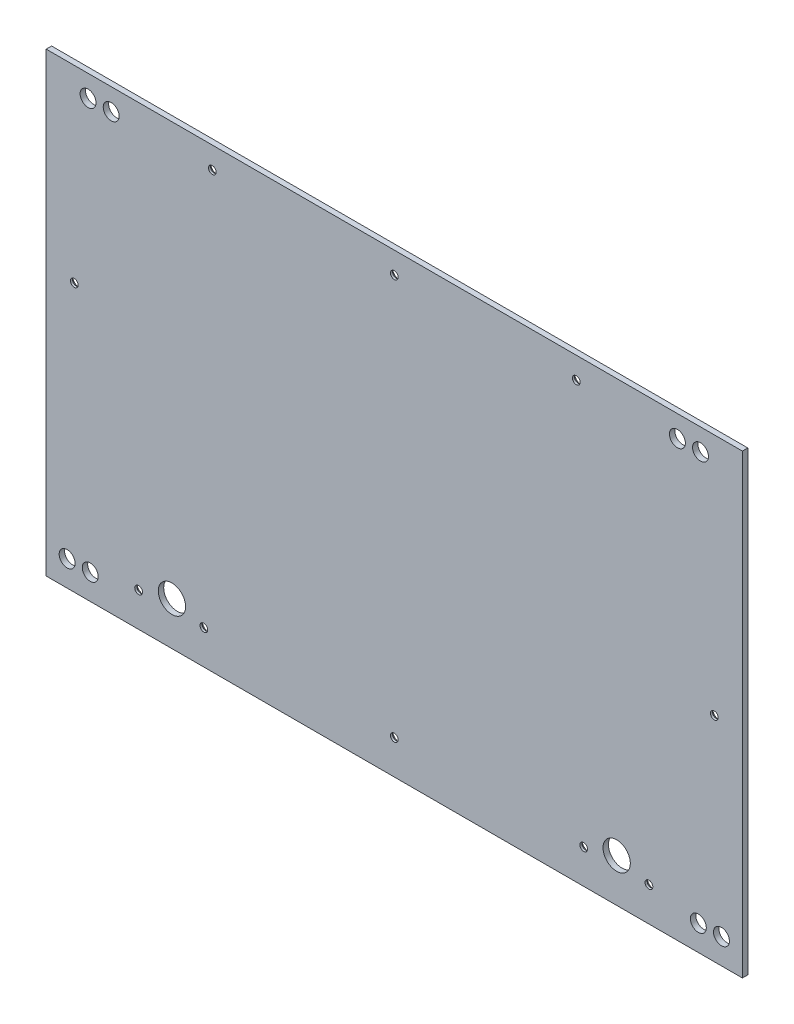
from build123d import *

# Parameters (mm, degrees)
SKETCH1_W                                      = 306.05
SKETCH1_H                                      = 197.425
BOSS_EXTRUDE1_DEPTH                            = 2.38125
SKETCH9_W                                      = 306.05
SKETCH9_H                                      = 2.38125
BOSS_EXTRUDE2_DEPTH                            = 3.175
SKETCH10_R                                     = 3.5
CUT_EXTRUDE1_DEPTH                             = 184.856965146
CSK_FOR_M3_FLAT_HEAD_MACHINE_SCREW1_AT_2_COUNT = 2
CSK_FOR_M3_FLAT_HEAD_MACHINE_SCREW1_AT_2_PITCH = 28.69
CSK_FOR_M3_FLAT_HEAD_MACHINE_SCREW1_AT_3_COUNT = 2
CSK_FOR_M3_FLAT_HEAD_MACHINE_SCREW1_AT_3_PITCH = 83.856540491
CSK_FOR_M3_FLAT_HEAD_MACHINE_SCREW1_AT_4_COUNT = 2
CSK_FOR_M3_FLAT_HEAD_MACHINE_SCREW1_AT_4_PITCH = 178.948509983
CSK_FOR_M3_FLAT_HEAD_MACHINE_SCREW1_AT_5_COUNT = 2
CSK_FOR_M3_FLAT_HEAD_MACHINE_SCREW1_AT_5_PITCH = 208.645558843
CSK_FOR_M3_FLAT_HEAD_MACHINE_SCREW1_AT_6_COUNT = 2
CSK_FOR_M3_FLAT_HEAD_MACHINE_SCREW1_AT_6_PITCH = 260.467597265
CSK_FOR_M3_FLAT_HEAD_MACHINE_SCREW1_AT_7_COUNT = 2
CSK_FOR_M3_FLAT_HEAD_MACHINE_SCREW1_AT_7_PITCH = 272.733119364
CSK_FOR_M3_FLAT_HEAD_MACHINE_SCREW1_AT_8_COUNT = 2
CSK_FOR_M3_FLAT_HEAD_MACHINE_SCREW1_AT_8_PITCH = 224.342
CSK_FOR_M3_FLAT_HEAD_MACHINE_SCREW1_AT_9_COUNT = 2
CSK_FOR_M3_FLAT_HEAD_MACHINE_SCREW1_AT_9_PITCH = 195.652
CSK_FOR_M3_FLAT_HEAD_MACHINE_SCREW1_AT_1_COUNT = 2
CSK_FOR_M3_FLAT_HEAD_MACHINE_SCREW1_AT_1_PITCH = 111.94
SKETCH13_R                                     = 6
CUT_EXTRUDE2_DEPTH                             = 184.856965146


with BuildPart() as part:
    # Sketch1 → Boss-Extrude1 (new body)
    with BuildSketch(Plane.XY):
        Rectangle(SKETCH1_W, SKETCH1_H)
    extrude(amount=BOSS_EXTRUDE1_DEPTH)

    # Sketch9 → Boss-Extrude2 (add)
    with BuildSketch(Plane(origin=(0, 98.7125, 0), x_dir=(1, 0, 0), z_dir=(0, 1, 0))):
        with Locations((0, -1.190625)):
            Rectangle(SKETCH9_W, SKETCH9_H)
    extrude(amount=BOSS_EXTRUDE2_DEPTH)

    # Sketch10 → Cut-Extrude1 (cut, through all)
    with BuildSketch(Plane(origin=(0, 0, 0), x_dir=(-1, 0, 0), z_dir=(0, 0, -1))):
        with Locations((-134.610000066, 92.362499989)):
            Circle(SKETCH10_R)
        with Locations((-124.450000066, 92.362499989)):
            Circle(SKETCH10_R)
        with Locations((-143.817500066, -87.537500111)):
            Circle(SKETCH10_R)
        with Locations((-133.657500066, -87.537500111)):
            Circle(SKETCH10_R)
    cut_extrude1 = extrude(amount=-CUT_EXTRUDE1_DEPTH, mode=Mode.SUBTRACT)

    # Mirror1: Cut-Extrude1 across plane
    add(cut_extrude1.mirror(Plane(origin=(0, 0, 0), x_dir=(0, 0, 1), z_dir=(1, 0, 0))), mode=Mode.SUBTRACT)

    # Sketch12 → CSK for M3 Flat Head Machine Screw1 (revolve, cut)
    with BuildSketch(Plane(origin=(111.94, -83.712500011, 0), x_dir=(0, 1, 0), z_dir=(1, 0, 0))):
        Polygon((0, 0), (0, 2.38125), (1.7, 2.38125), (1.7, 1.45), (3.15, 0), align=None)
    csk_for_m3_flat_head_machine_screw1 = revolve(axis=Axis((111.94, -83.712500011, -6.35), (0, 0, 1)), mode=Mode.SUBTRACT)

    # CSK for M3 Flat Head Machine Screw1 at 2: CSK for M3 Flat Head Machine Screw1 ×2
    with Locations(*[(-i * CSK_FOR_M3_FLAT_HEAD_MACHINE_SCREW1_AT_2_PITCH, 0, 0) for i in range(1, CSK_FOR_M3_FLAT_HEAD_MACHINE_SCREW1_AT_2_COUNT)]):
        add(csk_for_m3_flat_head_machine_screw1, mode=Mode.SUBTRACT)

    # CSK for M3 Flat Head Machine Screw1 at 3: CSK for M3 Flat Head Machine Screw1 ×2
    with Locations(*[Vector(0.3428176247747529, 0.9394019779326616, 0) * (i * CSK_FOR_M3_FLAT_HEAD_MACHINE_SCREW1_AT_3_PITCH) for i in range(1, CSK_FOR_M3_FLAT_HEAD_MACHINE_SCREW1_AT_3_COUNT)]):
        add(csk_for_m3_flat_head_machine_screw1, mode=Mode.SUBTRACT)

    # CSK for M3 Flat Head Machine Screw1 at 4: CSK for M3 Flat Head Machine Screw1 ×2
    with Locations(*[Vector(-0.17848709666868778, 0.9839422525345594, 0) * (i * CSK_FOR_M3_FLAT_HEAD_MACHINE_SCREW1_AT_4_PITCH) for i in range(1, CSK_FOR_M3_FLAT_HEAD_MACHINE_SCREW1_AT_4_COUNT)]):
        add(csk_for_m3_flat_head_machine_screw1, mode=Mode.SUBTRACT)

    # CSK for M3 Flat Head Machine Screw1 at 5: CSK for M3 Flat Head Machine Screw1 ×2
    with Locations(*[Vector(-0.5365079449598494, 0.8438952689729687, 0) * (i * CSK_FOR_M3_FLAT_HEAD_MACHINE_SCREW1_AT_5_PITCH) for i in range(1, CSK_FOR_M3_FLAT_HEAD_MACHINE_SCREW1_AT_5_COUNT)]):
        add(csk_for_m3_flat_head_machine_screw1, mode=Mode.SUBTRACT)

    # CSK for M3 Flat Head Machine Screw1 at 6: CSK for M3 Flat Head Machine Screw1 ×2
    with Locations(*[Vector(-0.7369054808176528, 0.6759957931384662, 0) * (i * CSK_FOR_M3_FLAT_HEAD_MACHINE_SCREW1_AT_6_PITCH) for i in range(1, CSK_FOR_M3_FLAT_HEAD_MACHINE_SCREW1_AT_6_COUNT)]):
        add(csk_for_m3_flat_head_machine_screw1, mode=Mode.SUBTRACT)

    # CSK for M3 Flat Head Machine Screw1 at 7: CSK for M3 Flat Head Machine Screw1 ×2
    with Locations(*[Vector(-0.9262809761508282, 0.37683358823367785, 0) * (i * CSK_FOR_M3_FLAT_HEAD_MACHINE_SCREW1_AT_7_PITCH) for i in range(1, CSK_FOR_M3_FLAT_HEAD_MACHINE_SCREW1_AT_7_COUNT)]):
        add(csk_for_m3_flat_head_machine_screw1, mode=Mode.SUBTRACT)

    # CSK for M3 Flat Head Machine Screw1 at 8: CSK for M3 Flat Head Machine Screw1 ×2
    with Locations(*[(-i * CSK_FOR_M3_FLAT_HEAD_MACHINE_SCREW1_AT_8_PITCH, 0, 0) for i in range(1, CSK_FOR_M3_FLAT_HEAD_MACHINE_SCREW1_AT_8_COUNT)]):
        add(csk_for_m3_flat_head_machine_screw1, mode=Mode.SUBTRACT)

    # CSK for M3 Flat Head Machine Screw1 at 9: CSK for M3 Flat Head Machine Screw1 ×2
    with Locations(*[(-i * CSK_FOR_M3_FLAT_HEAD_MACHINE_SCREW1_AT_9_PITCH, 0, 0) for i in range(1, CSK_FOR_M3_FLAT_HEAD_MACHINE_SCREW1_AT_9_COUNT)]):
        add(csk_for_m3_flat_head_machine_screw1, mode=Mode.SUBTRACT)

    # CSK for M3 Flat Head Machine Screw1 at 1: CSK for M3 Flat Head Machine Screw1 ×2
    with Locations(*[(-i * CSK_FOR_M3_FLAT_HEAD_MACHINE_SCREW1_AT_1_PITCH, 0, 0) for i in range(1, CSK_FOR_M3_FLAT_HEAD_MACHINE_SCREW1_AT_1_COUNT)]):
        add(csk_for_m3_flat_head_machine_screw1, mode=Mode.SUBTRACT)

    # Sketch13 → Cut-Extrude2 (cut, through all)
    with BuildSketch(Plane(origin=(0, 0, 0), x_dir=(-1, 0, 0), z_dir=(0, 0, -1))):
        with Locations((-97.75, -79.712500111)):
            Circle(SKETCH13_R)
        with Locations((97.75, -79.712500111)):
            Circle(SKETCH13_R)
    extrude(amount=-CUT_EXTRUDE2_DEPTH, mode=Mode.SUBTRACT)


solid = part.part
